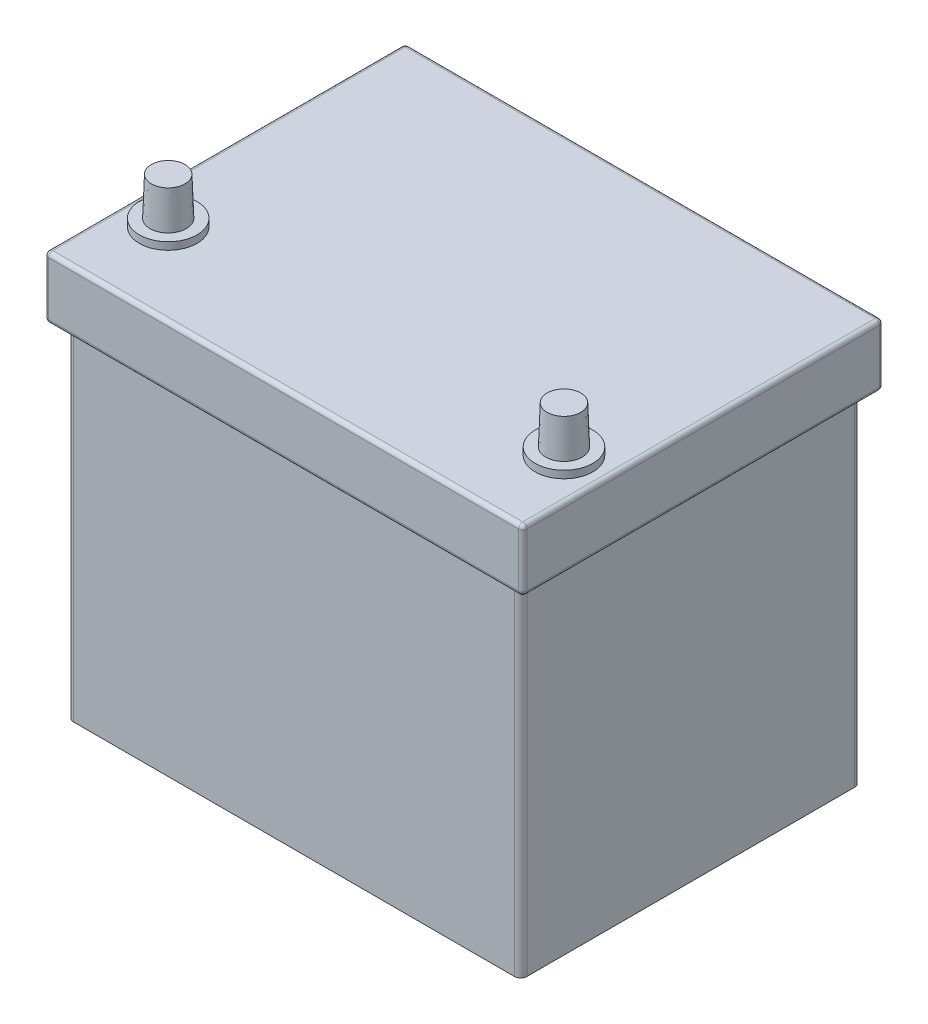
from build123d import *

# Parameters (mm, degrees)
SKETCH_1_W                = 220
SKETCH_1_H                = 165
EXTRUDE_1_DEPTH           = 166
FILLET_1_R                = 3
SKETCH_2_W                = 232
SKETCH_2_H                = 175
EXTRUDE_2_DEPTH           = 30
FILLET_2_R                = 2
SKETCH_3_R                = 14
EXTRUDE_3_DEPTH           = 3.6
SKETCH_5_R                = 8.8
EXTRUDE_4_DEPTH           = 18.5
EXTRUDE_4_DRAFT           = 2
EXTRUDE_4_PROFILE_2_DEPTH = 18.5
EXTRUDE_4_PROFILE_2_DRAFT = 2


with BuildPart() as part:
    # Эскиз1 → Вытянуть1 (new body)
    with BuildSketch(Plane(origin=(0, 0, 0), x_dir=(1, 0, 0), z_dir=(0, 1, 0))):
        Rectangle(SKETCH_1_W, SKETCH_1_H)
    extrude(amount=EXTRUDE_1_DEPTH)

    # Скругление1
    fillet_1_edges = [part.edges().sort_by_distance(p)[0] for p in [
        (-110, 83, -82.5),
        (110, 83, -82.5),
        (110, 83, 82.5),
        (-110, 83, 82.5),
    ]]
    fillet(fillet_1_edges, radius=FILLET_1_R)

    # Эскиз2 → Вытянуть2 (add)
    with BuildSketch(Plane(origin=(0, 166, 0), x_dir=(1, 0, 0), z_dir=(0, 1, 0))):
        Rectangle(SKETCH_2_W, SKETCH_2_H)
    extrude(amount=EXTRUDE_2_DEPTH)

    # Скругление2
    fillet_2_edges = [part.edges().sort_by_distance(p)[0] for p in [
        (116, 166, 0),
        (116, 181, 87.5),
        (0, 196, 87.5),
        (-116, 181, 87.5),
        (-116, 196, 0),
        (-116, 181, -87.5),
        (0, 196, -87.5),
        (116, 196, 0),
        (116, 181, -87.5),
        (0, 166, -87.5),
        (-116, 166, 0),
        (0, 166, 87.5),
    ]]
    fillet(fillet_2_edges, radius=FILLET_2_R)

    # Эскиз3 → Вытянуть3 (add)
    with BuildSketch(Plane(origin=(0, 196, 0), x_dir=(1, 0, 0), z_dir=(0, 1, 0))):
        with Locations((96, -47.5)):
            Circle(SKETCH_3_R)
        with Locations((-96, -47.5)):
            Circle(SKETCH_3_R)
    extrude(amount=EXTRUDE_3_DEPTH)


with BuildPart() as extrude_4_tool:
    # Эскиз5 → Вытянуть4 (with draft: the straight prism first)
    with BuildSketch(Plane(origin=(0, 199.6, 0), x_dir=(1, 0, 0), z_dir=(0, 1, 0))):
        with Locations((96, -47.5)):
            Circle(SKETCH_5_R)
    extrude(amount=EXTRUDE_4_DEPTH)
    # Вытянуть4: the draft: its side faces are tilted about the plane it starts from
    extrude_4_sides = [extrude_4_tool.faces().sort_by_distance(p)[0] for p in [
        (87.2, 208.85, 47.5),
    ]]
    draft(extrude_4_sides, Plane(origin=(0, 199.6, 0), x_dir=(1, 0, 0), z_dir=(0, 1, 0)), EXTRUDE_4_DRAFT)


with BuildPart() as part_1:
    add(part.part)

    # Вытянуть4: add extrude_4_tool
    add(extrude_4_tool.part)


with BuildPart() as extrude_4_profile_2_tool:
    # Эскиз5 → Вытянуть4 profile 2 (with draft: the straight prism first)
    with BuildSketch(Plane(origin=(0, 199.6, 0), x_dir=(1, 0, 0), z_dir=(0, 1, 0))):
        with Locations((-96, -47.5)):
            Circle(SKETCH_5_R)
    extrude(amount=EXTRUDE_4_PROFILE_2_DEPTH)
    # Вытянуть4 profile 2: the draft: its side faces are tilted about the plane it starts from
    extrude_4_profile_2_sides = [extrude_4_profile_2_tool.faces().sort_by_distance(p)[0] for p in [
        (-104.8, 208.85, 47.5),
    ]]
    draft(extrude_4_profile_2_sides, Plane(origin=(0, 199.6, 0), x_dir=(1, 0, 0), z_dir=(0, 1, 0)), EXTRUDE_4_PROFILE_2_DRAFT)


with BuildPart() as part_2:
    add(part_1.part)

    # Вытянуть4 profile 2: add extrude_4_profile_2_tool
    add(extrude_4_profile_2_tool.part)


solid = part_2.part
